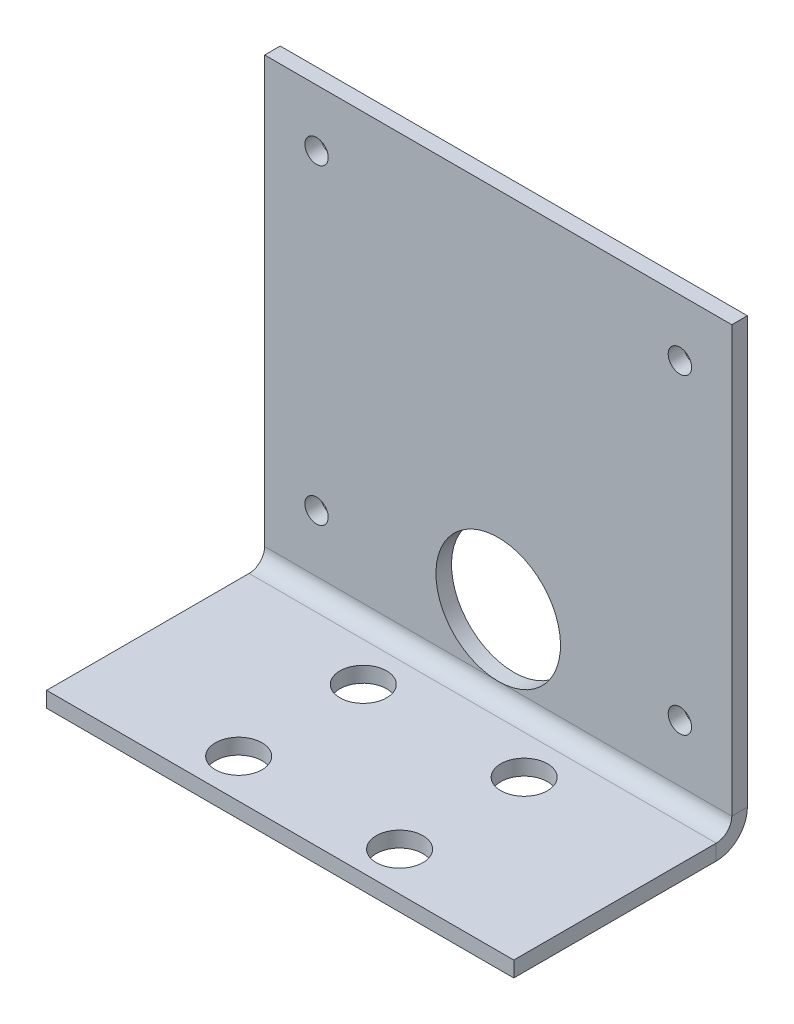
from build123d import *

# Parameters (mm, degrees)
SCHIZZO1_W                     = 90
SCHIZZO1_H                     = 100
BASE_FLANGIA1_DEPTH            = 3
BORDO_FLANGIA1_STRIP_W         = 18
BORDO_FLANGIA1_STRIP_H         = 3
BORDO_FLANGIA1_STRIP_CUT_DEPTH = 90
BORDO_FLANGIA1_DEPTH           = 90
RACCORDO1_R                    = 10
SCHIZZO10_R                    = 4.5
TAGLIO_ESTRUSIONE1_DEPTH       = 10
SCHIZZO9_R                     = 12
TAGLIO_ESTRUSIONE2_DEPTH       = 10
SCHIZZO11_W                    = 90
SCHIZZO11_H                    = 58
TAGLIO_ESTRUSIONE3_DEPTH       = 10
SCHIZZO12_W                    = 90
SCHIZZO12_H                    = 15
TAGLIO_ESTRUSIONE4_DEPTH       = 10
FORO_START                     = -103
FORO_PER_VITE_M4_1_OUTLINE_R   = 2.25
FORO_PER_VITE_M4_1_DEPTH       = 3


# Read off the part's stored shape, not the designer's step: Foro per Vite M4-1
# Sheet-metal steps are written as plain solids
with BuildPart() as part:
    # Schizzo1 → Base-Flangia1 (new body)
    with BuildSketch(Plane(origin=(0, 0, 0), x_dir=(1, 0, 0), z_dir=(0, 1, 0))):
        with Locations((-45, 50)):
            Rectangle(SCHIZZO1_W, SCHIZZO1_H)
    extrude(amount=-BASE_FLANGIA1_DEPTH)

    # Bordo-Flangia1 strip (across the edge) → Bordo-Flangia1 strip cut (cut)
    with BuildSketch(Plane(origin=(0, 0, -100), x_dir=(0, 0, 1), z_dir=(-1, 0, 0))):
        with Locations((-6, -1.5)):
            Rectangle(BORDO_FLANGIA1_STRIP_W, BORDO_FLANGIA1_STRIP_H)
    extrude(amount=BORDO_FLANGIA1_STRIP_CUT_DEPTH, mode=Mode.SUBTRACT)

    # Bordo-Flangia1 section (across the edge) → Bordo-Flangia1 (add)
    with BuildSketch(Plane(origin=(0, 0, -100), x_dir=(0, 0, 1), z_dir=(-1, 0, 0))):
        with BuildLine():
            Line((-3, 3), (-3, 100))
            Line((-3, 100), (0, 100))
            Line((0, 100), (0, 3))
            ThreePointArc((0, 3), (0.878679656, 0.878679656), (3, 0))
            Line((3, 0), (3, -3))
            ThreePointArc((3, -3), (-1.242640687, -1.242640687), (-3, 3))
        make_face()
    extrude(amount=BORDO_FLANGIA1_DEPTH)

    # Raccordo1
    raccordo1_edges = [part.edges().sort_by_distance(p)[0] for p in [
        (0, 100, -101.5),
        (-90, 100, -101.5),
        (0, -1.5, 0),
        (-90, -1.5, 0),
    ]]
    fillet(raccordo1_edges, radius=RACCORDO1_R)

    # Schizzo10 → Taglio-Estrusione1 (cut)
    with BuildSketch(Plane.XZ.offset(3)):
        with Locations(Location((-60.5, -89.5, 0), (0, 0, 270))):
            Circle(SCHIZZO10_R)
        with Locations(Location((-60.5, -65.5, 0), (0, 0, 270))):
            Circle(SCHIZZO10_R)
        with Locations(Location((-29.5, -65.5, 0), (0, 0, 270))):
            Circle(SCHIZZO10_R)
        with Locations(Location((-29.5, -89.5, 0), (0, 0, 270))):
            Circle(SCHIZZO10_R)
    extrude(amount=-TAGLIO_ESTRUSIONE1_DEPTH, mode=Mode.SUBTRACT)

    # Schizzo9 → Taglio-Estrusione2 (cut)
    with BuildSketch(Plane.XY.offset(-100)):
        with Locations(Location((-45, 15, 0), (0, 0, 270))):
            Circle(SCHIZZO9_R)
    extrude(amount=-TAGLIO_ESTRUSIONE2_DEPTH, mode=Mode.SUBTRACT)

    # Schizzo11 → Taglio-Estrusione3 (cut)
    with BuildSketch(Plane(origin=(0, 0, 0), x_dir=(1, 0, 0), z_dir=(0, 1, 0))):
        with Locations((-45, 29)):
            Rectangle(SCHIZZO11_W, SCHIZZO11_H)
    extrude(amount=-TAGLIO_ESTRUSIONE3_DEPTH, mode=Mode.SUBTRACT)

    # Schizzo12 → Taglio-Estrusione4 (cut)
    with BuildSketch(Plane.XY.offset(-100)):
        with Locations((-45, 92.5)):
            Rectangle(SCHIZZO12_W, SCHIZZO12_H)
    extrude(amount=-TAGLIO_ESTRUSIONE4_DEPTH, mode=Mode.SUBTRACT)

    # Foro per Vite M4-1 outline → Foro per Vite M4-1 (cut)
    with BuildSketch(Plane.XY.offset(FORO_START)):
        with Locations((-10, 74)):
            Circle(FORO_PER_VITE_M4_1_OUTLINE_R)
        with Locations((-80, 14)):
            Circle(FORO_PER_VITE_M4_1_OUTLINE_R)
        with Locations((-10, 14)):
            Circle(FORO_PER_VITE_M4_1_OUTLINE_R)
        with Locations((-80, 74)):
            Circle(FORO_PER_VITE_M4_1_OUTLINE_R)
    extrude(amount=FORO_PER_VITE_M4_1_DEPTH, mode=Mode.SUBTRACT)


solid = part.part
